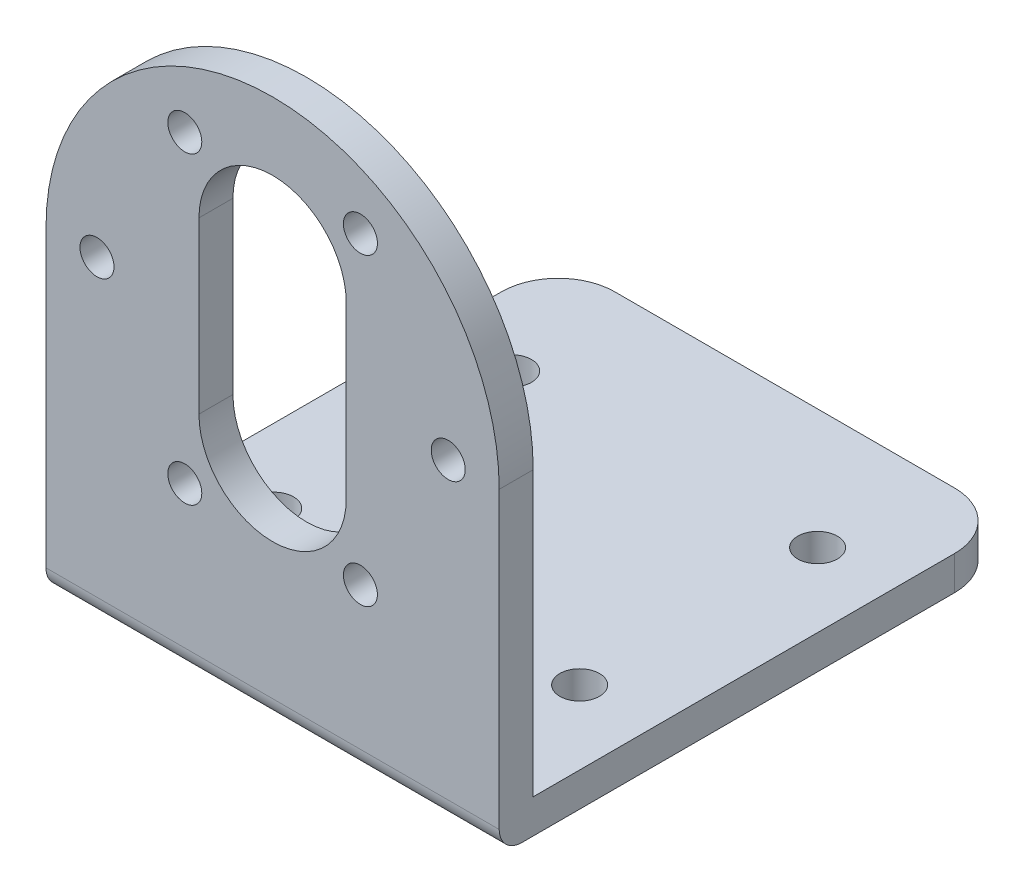
from build123d import *

# Parameters (mm, degrees)
CROQUIS1_R              = 1.5
SALIENTE_EXTRUIR1_DEPTH = 1.5
CORTAR_EXTRUIR3_DEPTH   = 3
CROQUIS3_W              = 40
CROQUIS3_H              = 3
SALIENTE_EXTRUIR2_DEPTH = 42.2
CROQUIS4_R              = 1.75
CORTAR_EXTRUIR5_DEPTH   = 42.2
REDONDEO1_R             = 2
REDONDEO2_R             = 5


with BuildPart() as part:
    # Croquis1 → Saliente-Extruir1 (new, symmetric)
    with BuildSketch(Plane.XY):
        with BuildLine():
            Line((-20, -24), (20, -24))
            Line((20, -24), (20, 4))
            ThreePointArc((20, 4), (0, 24), (-20, 4))
            Line((-20, 4), (-20, -24))
        make_face()
        with Locations((-15.5, 4)):
            Circle(CROQUIS1_R, mode=Mode.SUBTRACT)
        with Locations((-7.75, 17.423393759)):
            Circle(CROQUIS1_R, mode=Mode.SUBTRACT)
        with Locations((7.75, 17.423393759)):
            Circle(CROQUIS1_R, mode=Mode.SUBTRACT)
        with Locations((15.5, 4)):
            Circle(CROQUIS1_R, mode=Mode.SUBTRACT)
        with Locations((7.75, -9.423393759)):
            Circle(CROQUIS1_R, mode=Mode.SUBTRACT)
        with Locations((-7.75, -9.423393759)):
            Circle(CROQUIS1_R, mode=Mode.SUBTRACT)
    extrude(amount=SALIENTE_EXTRUIR1_DEPTH, both=True)

    # Croquis2 → Cortar-Extruir3 (cut)
    with BuildSketch(Plane.XY.offset(1.5)):
        with BuildLine():
            Line((6.5, 11.5), (6.5, -3.5))
            ThreePointArc((6.5, -3.5), (0, -10), (-6.5, -3.5))
            Line((-6.5, -3.5), (-6.5, 11.5))
            ThreePointArc((-6.5, 11.5), (0, 18), (6.5, 11.5))
        make_face()
    extrude(amount=-CORTAR_EXTRUIR3_DEPTH, mode=Mode.SUBTRACT)

    # Croquis3 → Saliente-Extruir2 (add)
    with BuildSketch(Plane(origin=(0, 0, -1.5), x_dir=(-1, 0, 0), z_dir=(0, 0, -1))):
        with Locations((0, -22.5)):
            Rectangle(CROQUIS3_W, CROQUIS3_H)
    extrude(amount=SALIENTE_EXTRUIR2_DEPTH)

    # Croquis4 → Cortar-Extruir5 (cut)
    with BuildSketch(Plane(origin=(0, -21, 0), x_dir=(1, 0, 0), z_dir=(0, 1, 0))):
        with Locations((-13.5, 33.1)):
            Circle(CROQUIS4_R)
        with Locations((13.5, 33.1)):
            Circle(CROQUIS4_R)
        with Locations((13.5, 12.1)):
            Circle(CROQUIS4_R)
        with Locations((-13.5, 12.1)):
            Circle(CROQUIS4_R)
    extrude(amount=-CORTAR_EXTRUIR5_DEPTH, mode=Mode.SUBTRACT)

    # Redondeo1
    redondeo1_edges = [part.edges().sort_by_distance(p)[0] for p in [
        (0, -24, 1.5),
    ]]
    fillet(redondeo1_edges, radius=REDONDEO1_R)

    # Redondeo2
    redondeo2_edges = [part.edges().sort_by_distance(p)[0] for p in [
        (-20, -22.5, -43.7),
        (20, -22.5, -43.7),
    ]]
    fillet(redondeo2_edges, radius=REDONDEO2_R)


solid = part.part
